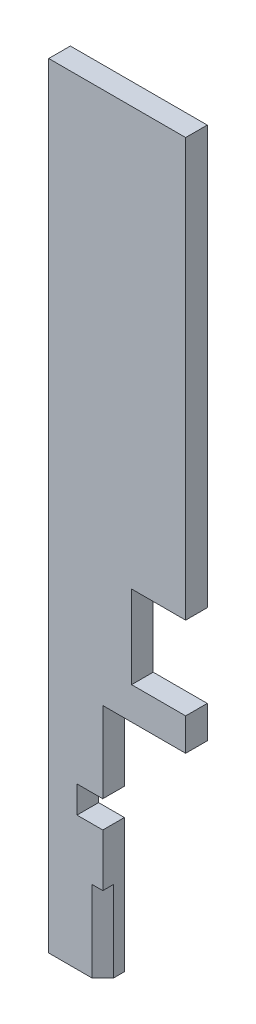
from build123d import *

# Parameters (mm, degrees)
ESQUISSE1_W             = 38
ESQUISSE1_H             = 215
BOSS_EXTRU_1_DEPTH      = 6
ESQUISSE2_W             = 15
ESQUISSE2_H             = 23
ENL_V_MAT_EXTRU_1_DEPTH = 219.414743092
ESQUISSE3_W             = 20
ESQUISSE3_H             = 22.5
ENL_V_MAT_EXTRU_2_DEPTH = 7.5
CHANFREIN1_SIZE         = 6
ESQUISSE4_W             = 23
ESQUISSE4_H             = 67
ENL_V_MAT_EXTRU_3_DEPTH = 219.414743092
ESQUISSE5_W             = 7.158748458
ESQUISSE5_H             = 7.5
ENL_V_MAT_EXTRU_4_DEPTH = 219.414743092
ESQUISSE6_R             = 2.5
ENL_V_MAT_EXTRU_5_DEPTH = 10


with BuildPart() as part:
    # Esquisse1 → Boss.-Extru.1 (new body)
    with BuildSketch(Plane.XY):
        with Locations((19, 107.5)):
            Rectangle(ESQUISSE1_W, ESQUISSE1_H)
    extrude(amount=BOSS_EXTRU_1_DEPTH)

    # Esquisse2 → Enlèv. mat.-Extru.1 (cut, through all)
    with BuildSketch(Plane(origin=(0, 0, 0), x_dir=(-1, 0, 0), z_dir=(0, 0, -1))):
        with Locations((-30.5, 87.5)):
            Rectangle(ESQUISSE2_W, ESQUISSE2_H)
    extrude(amount=-ENL_V_MAT_EXTRU_1_DEPTH, mode=Mode.SUBTRACT)

    # Esquisse3 → Enlèv. mat.-Extru.2 (cut)
    with BuildSketch(Plane.XY.offset(6)):
        with Locations((28, 11.25)):
            Rectangle(ESQUISSE3_W, ESQUISSE3_H)
    extrude(amount=-ENL_V_MAT_EXTRU_2_DEPTH, mode=Mode.SUBTRACT)

    # Chanfrein1
    chanfrein1_edges = [part.edges().sort_by_distance(p)[0] for p in [
        (18, 11.25, 6),
    ]]
    chamfer(chanfrein1_edges, length=CHANFREIN1_SIZE - 0.0001)  # a hair under: the kernel refuses the full size

    # Esquisse4 → Enlèv. mat.-Extru.3 (cut, through all)
    with BuildSketch(Plane(origin=(0, 0, 0), x_dir=(-1, 0, 0), z_dir=(0, 0, -1))):
        with Locations((-26.5, 33.5)):
            Rectangle(ESQUISSE4_W, ESQUISSE4_H)
    extrude(amount=-ENL_V_MAT_EXTRU_3_DEPTH, mode=Mode.SUBTRACT)

    # Esquisse5 → Enlèv. mat.-Extru.4 (cut, through all)
    with BuildSketch(Plane(origin=(0, 0, 0), x_dir=(-1, 0, 0), z_dir=(0, 0, -1))):
        with Locations((-11.420625771, 40.825425785)):
            Rectangle(ESQUISSE5_W, ESQUISSE5_H)
    extrude(amount=-ENL_V_MAT_EXTRU_4_DEPTH, mode=Mode.SUBTRACT)

    # Esquisse6 → Enlèv. mat.-Extru.5 (cut)
    with BuildSketch(Plane(origin=(0, 0, 0), x_dir=(-1, 0, 0), z_dir=(0, -1, 0))):
        with Locations(Location((-6, -3, 0), (0, 0, 180))):
            Circle(ESQUISSE6_R)
    extrude(amount=-ENL_V_MAT_EXTRU_5_DEPTH, mode=Mode.SUBTRACT)


solid = part.part
